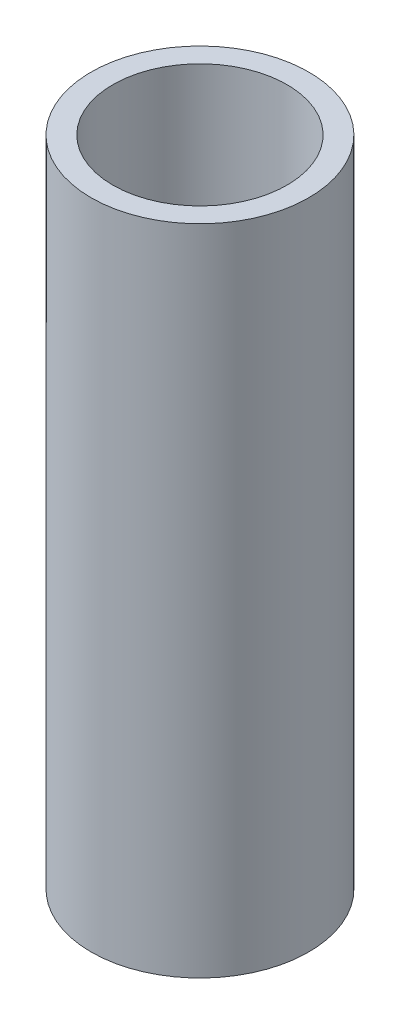
from build123d import *

# Parameters (mm, degrees)
SKETCH_1_R               = 5
EXTRUDE_3_DEPTH          = 15
CUT_EXTRUDE_1_DEPTH      = 17.583123952
CUT_EXTRUDE_1_DEPTH_BACK = 17.583123952
SKETCH_1_10_R            = 4


with BuildPart() as part:
    # 草图1 → 凸台-拉伸3 (new, symmetric)
    with BuildSketch(Plane(origin=(0, 0, 0), x_dir=(1, 0, 0), z_dir=(0, 1, 0))):
        Circle(SKETCH_1_R)
    extrude(amount=EXTRUDE_3_DEPTH, both=True)

    # 草图1<10> → 切除-拉伸1 (cut, two sides: drawn at the far end of the back side and taken through both)
    with BuildSketch(Plane(origin=(0, 0, 0), x_dir=(1, 0, 0), z_dir=(0, 1, 0)).offset(-CUT_EXTRUDE_1_DEPTH_BACK)):
        Circle(SKETCH_1_10_R)
    extrude(amount=CUT_EXTRUDE_1_DEPTH + CUT_EXTRUDE_1_DEPTH_BACK, mode=Mode.SUBTRACT)


solid = part.part
